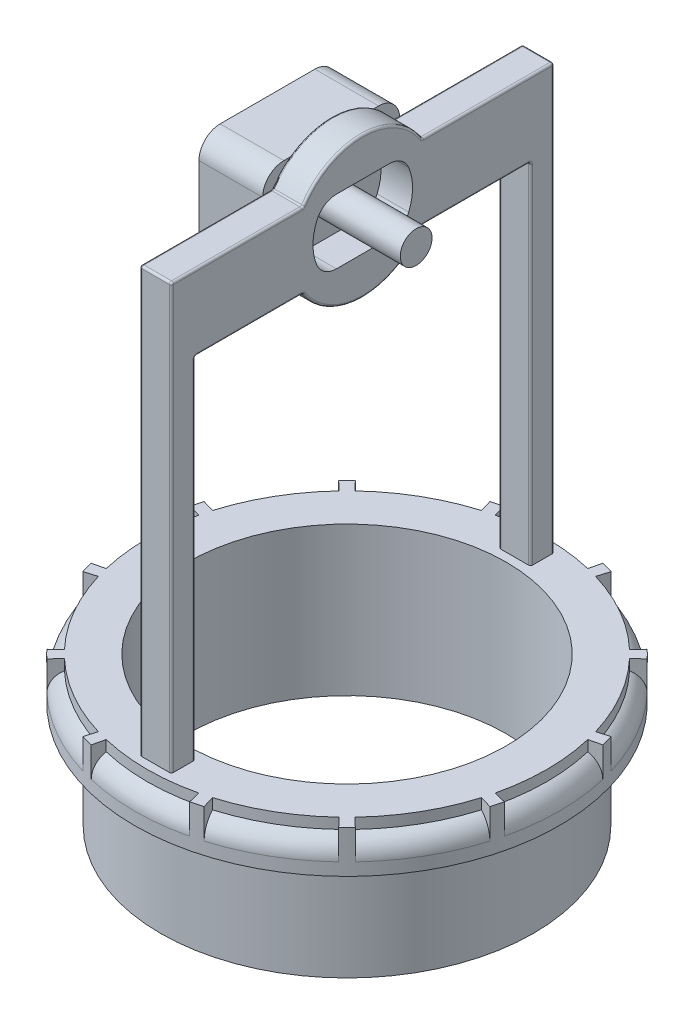
from build123d import *

# Parameters (mm, degrees)
SKETCH1_R           = 100
BOSS_EXTRUDE1_DEPTH = 20
SKETCH2_R           = 75
CUT_EXTRUDE1_DEPTH  = 20
BOSS_EXTRUDE2_START = 50
SKETCH3_R           = 87.864949358
SKETCH3_R_2         = 75
BOSS_EXTRUDE2_DEPTH = 50
CUT_EXTRUDE2_START  = -5
CUT_EXTRUDE2_DEPTH  = 5
FILLET1_START       = -1e-07
FILLET1_2_DEPTH     = 15.0000001
SKETCH5_W           = 14.86632225
SKETCH5_H           = 11.123248352
BOSS_EXTRUDE3_DEPTH = 200
BOSS_EXTRUDE4_REACH = 302.737
SKETCH6_W           = 14.86632225
SKETCH6_H           = 35.482101201
SKETCH7_R           = 33.276381549
BOSS_EXTRUDE5_DEPTH = 14.86632225
CUT_EXTRUDE3_DEPTH  = 278.522568948
FILLET2_R           = 1
BOSS_EXTRUDE6_DEPTH = 30
SKETCH10_R          = 7.5
BOSS_EXTRUDE7_DEPTH = 40


with BuildPart() as part:
    # Sketch1 → Boss-Extrude1 (new body)
    with BuildSketch(Plane(origin=(0, 0, 0), x_dir=(1, 0, 0), z_dir=(0, 1, 0))):
        with Locations(Location((0, 0, 0), (0, 0, 270))):
            Circle(SKETCH1_R)
    extrude(amount=BOSS_EXTRUDE1_DEPTH)

    # Sketch2 → Cut-Extrude1 (cut)
    with BuildSketch(Plane.XZ):
        with Locations(Location((0, 0, 0), (0, 0, 270))):
            Circle(SKETCH2_R)
    extrude(amount=-CUT_EXTRUDE1_DEPTH, mode=Mode.SUBTRACT)

    # Sketch3 → Boss-Extrude2 (add)
    with BuildSketch(Plane.XZ.offset(BOSS_EXTRUDE2_START)):
        with Locations(Location((0, 0, 0), (0, 0, 270))):
            Circle(SKETCH3_R)
        with Locations(Location((0, 0, 0), (0, 0, 270))):
            Circle(SKETCH3_R_2, mode=Mode.SUBTRACT)
    extrude(amount=-BOSS_EXTRUDE2_DEPTH)

    # Sketch4 → Cut-Extrude2 (cut)
    with BuildSketch(Plane(origin=(0, 20, 0), x_dir=(1, 0, 0), z_dir=(0, 1, 0)).offset(CUT_EXTRUDE2_START)):
        with BuildLine():
            Line((-23.19382118, 97.27305207), (-21.833368998, 91.567423188))
            ThreePointArc((-21.833368998, 91.567423188), (0, 94.1344198), (21.833368998, 91.567423188))
            Line((21.833368998, 91.567423188), (23.19382118, 97.27305207))
            ThreePointArc((23.19382118, 97.27305207), (0, 100), (-23.19382118, 97.27305207))
        make_face()
        with BuildLine():
            Line((28.550087682, 95.837844787), (26.875459392, 90.216399139))
            ThreePointArc((26.875459392, 90.216399139), (47.0672099, 81.522798918), (64.691963796, 68.383030141))
            Line((64.691963796, 68.383030141), (68.722964388, 72.644023606))
            ThreePointArc((68.722964388, 72.644023606), (50, 86.602540378), (28.550087682, 95.837844787))
        make_face()
        with BuildLine():
            Line((72.644023606, 68.722964388), (68.383030141, 64.691963796))
            ThreePointArc((68.383030141, 64.691963796), (81.522798918, 47.0672099), (90.216399139, 26.875459392))
            Line((90.216399139, 26.875459392), (95.837844787, 28.550087682))
            ThreePointArc((95.837844787, 28.550087682), (86.602540378, 50), (72.644023606, 68.722964388))
        make_face()
        with BuildLine():
            Line((97.27305207, 23.19382118), (91.567423188, 21.833368998))
            ThreePointArc((91.567423188, 21.833368998), (94.1344198, 0), (91.567423188, -21.833368998))
            Line((91.567423188, -21.833368998), (97.27305207, -23.19382118))
            ThreePointArc((97.27305207, -23.19382118), (100, 0), (97.27305207, 23.19382118))
        make_face()
        with BuildLine():
            Line((95.837844787, -28.550087682), (90.216399139, -26.875459392))
            ThreePointArc((90.216399139, -26.875459392), (81.522798918, -47.0672099), (68.383030141, -64.691963796))
            Line((68.383030141, -64.691963796), (72.644023606, -68.722964388))
            ThreePointArc((72.644023606, -68.722964388), (86.602540378, -50), (95.837844787, -28.550087682))
        make_face()
        with BuildLine():
            Line((68.722964388, -72.644023606), (64.691963796, -68.383030141))
            ThreePointArc((64.691963796, -68.383030141), (47.0672099, -81.522798918), (26.875459392, -90.216399139))
            Line((26.875459392, -90.216399139), (28.550087682, -95.837844787))
            ThreePointArc((28.550087682, -95.837844787), (50, -86.602540378), (68.722964388, -72.644023606))
        make_face()
        with BuildLine():
            Line((23.19382118, -97.27305207), (21.833368998, -91.567423188))
            ThreePointArc((21.833368998, -91.567423188), (0, -94.1344198), (-21.833368998, -91.567423188))
            Line((-21.833368998, -91.567423188), (-23.19382118, -97.27305207))
            ThreePointArc((-23.19382118, -97.27305207), (0, -100), (23.19382118, -97.27305207))
        make_face()
        with BuildLine():
            Line((-28.550087682, -95.837844787), (-26.875459392, -90.216399139))
            ThreePointArc((-26.875459392, -90.216399139), (-47.0672099, -81.522798918), (-64.691963796, -68.383030141))
            Line((-64.691963796, -68.383030141), (-68.722964388, -72.644023606))
            ThreePointArc((-68.722964388, -72.644023606), (-50, -86.602540378), (-28.550087682, -95.837844787))
        make_face()
        with BuildLine():
            Line((-72.644023606, -68.722964388), (-68.383030141, -64.691963796))
            ThreePointArc((-68.383030141, -64.691963796), (-81.522798918, -47.0672099), (-90.216399139, -26.875459392))
            Line((-90.216399139, -26.875459392), (-95.837844787, -28.550087682))
            ThreePointArc((-95.837844787, -28.550087682), (-86.602540378, -50), (-72.644023606, -68.722964388))
        make_face()
        with BuildLine():
            Line((-97.27305207, -23.19382118), (-91.567423188, -21.833368998))
            ThreePointArc((-91.567423188, -21.833368998), (-94.1344198, 0), (-91.567423188, 21.833368998))
            Line((-91.567423188, 21.833368998), (-97.27305207, 23.19382118))
            ThreePointArc((-97.27305207, 23.19382118), (-100, 0), (-97.27305207, -23.19382118))
        make_face()
        with BuildLine():
            Line((-95.837844787, 28.550087682), (-90.216399139, 26.875459392))
            ThreePointArc((-90.216399139, 26.875459392), (-81.522798918, 47.0672099), (-68.383030141, 64.691963796))
            Line((-68.383030141, 64.691963796), (-72.644023606, 68.722964388))
            ThreePointArc((-72.644023606, 68.722964388), (-86.602540378, 50), (-95.837844787, 28.550087682))
        make_face()
        with BuildLine():
            Line((-68.722964388, 72.644023606), (-64.691963796, 68.383030141))
            ThreePointArc((-64.691963796, 68.383030141), (-47.0672099, 81.522798918), (-26.875459392, 90.216399139))
            Line((-26.875459392, 90.216399139), (-28.550087682, 95.837844787))
            ThreePointArc((-28.550087682, 95.837844787), (-50, 86.602540378), (-68.722964388, 72.644023606))
        make_face()
    extrude(amount=CUT_EXTRUDE2_DEPTH, mode=Mode.SUBTRACT)

    # Fillet1: read off the stored shape, not the designer's step
    # Fillet1 outline → Fillet1 (revolve, cut)
    with BuildSketch(Plane.XY):
        with BuildLine():
            ThreePointArc((94.1344198, 15), (98.406669912, 11.310219416), (100, 5.894695342))
            Line((100, 5.894695342), (100, 15))
            Line((100, 15), (94.1344198, 15))
        make_face()
    revolve(axis=Axis((0, 0, 0), (0, 1, 0)), mode=Mode.SUBTRACT)

    # Fillet1 2 outline → Fillet1 2 (add)
    with BuildSketch(Plane(origin=(0, 0, 0), x_dir=(1, 0, 0), z_dir=(0, 1, 0)).offset(FILLET1_START)):
        with BuildLine():
            ThreePointArc((-28.550087682, -95.837844787), (-25.88190451, -96.592582629), (-23.19382118, -97.27305207))
            Line((-23.19382118, -97.27305207), (-21.833368998, -91.567423188))
            ThreePointArc((-21.833368998, -91.567423188), (-24.363780644, -90.926867228), (-26.875459392, -90.216399139))
            Line((-26.875459392, -90.216399139), (-28.550087682, -95.837844787))
        make_face()
        with BuildLine():
            Line((91.567423188, 21.833368998), (97.27305207, 23.19382118))
            ThreePointArc((97.27305207, 23.19382118), (96.592582629, 25.88190451), (95.837844787, 28.550087682))
            Line((95.837844787, 28.550087682), (90.216399139, 26.875459392))
            ThreePointArc((90.216399139, 26.875459392), (90.926867228, 24.363780644), (91.567423188, 21.833368998))
        make_face()
        with BuildLine():
            Line((68.383030141, 64.691963796), (72.644023606, 68.722964388))
            ThreePointArc((72.644023606, 68.722964388), (70.710678119, 70.710678119), (68.722964388, 72.644023606))
            Line((68.722964388, 72.644023606), (64.691963796, 68.383030141))
            ThreePointArc((64.691963796, 68.383030141), (66.563086584, 66.563086584), (68.383030141, 64.691963796))
        make_face()
        with BuildLine():
            Line((26.875459392, 90.216399139), (28.550087682, 95.837844787))
            ThreePointArc((28.550087682, 95.837844787), (25.88190451, 96.592582629), (23.19382118, 97.27305207))
            Line((23.19382118, 97.27305207), (21.833368998, 91.567423188))
            ThreePointArc((21.833368998, 91.567423188), (24.363780644, 90.926867228), (26.875459392, 90.216399139))
        make_face()
        with BuildLine():
            Line((-21.833368998, 91.567423188), (-23.19382118, 97.27305207))
            ThreePointArc((-23.19382118, 97.27305207), (-25.88190451, 96.592582629), (-28.550087682, 95.837844787))
            Line((-28.550087682, 95.837844787), (-26.875459392, 90.216399139))
            ThreePointArc((-26.875459392, 90.216399139), (-24.363780644, 90.926867228), (-21.833368998, 91.567423188))
        make_face()
        with BuildLine():
            Line((-64.691963796, 68.383030141), (-68.722964388, 72.644023606))
            ThreePointArc((-68.722964388, 72.644023606), (-70.710678119, 70.710678119), (-72.644023606, 68.722964388))
            Line((-72.644023606, 68.722964388), (-68.383030141, 64.691963796))
            ThreePointArc((-68.383030141, 64.691963796), (-66.563086584, 66.563086584), (-64.691963796, 68.383030141))
        make_face()
        with BuildLine():
            Line((-90.216399139, 26.875459392), (-95.837844787, 28.550087682))
            ThreePointArc((-95.837844787, 28.550087682), (-96.592582629, 25.88190451), (-97.27305207, 23.19382118))
            Line((-97.27305207, 23.19382118), (-91.567423188, 21.833368998))
            ThreePointArc((-91.567423188, 21.833368998), (-90.926867228, 24.363780644), (-90.216399139, 26.875459392))
        make_face()
        with BuildLine():
            ThreePointArc((-97.27305207, -23.19382118), (-96.592582629, -25.88190451), (-95.837844787, -28.550087682))
            Line((-95.837844787, -28.550087682), (-90.216399139, -26.875459392))
            ThreePointArc((-90.216399139, -26.875459392), (-90.926867228, -24.363780644), (-91.567423188, -21.833368998))
            Line((-91.567423188, -21.833368998), (-97.27305207, -23.19382118))
        make_face()
        with BuildLine():
            ThreePointArc((-72.644023606, -68.722964388), (-70.710678119, -70.710678119), (-68.722964388, -72.644023606))
            Line((-68.722964388, -72.644023606), (-64.691963796, -68.383030141))
            ThreePointArc((-64.691963796, -68.383030141), (-66.563086584, -66.563086584), (-68.383030141, -64.691963796))
            Line((-68.383030141, -64.691963796), (-72.644023606, -68.722964388))
        make_face()
        with BuildLine():
            ThreePointArc((23.19382118, -97.27305207), (25.88190451, -96.592582629), (28.550087682, -95.837844787))
            Line((28.550087682, -95.837844787), (26.875459392, -90.216399139))
            ThreePointArc((26.875459392, -90.216399139), (24.363780644, -90.926867228), (21.833368998, -91.567423188))
            Line((21.833368998, -91.567423188), (23.19382118, -97.27305207))
        make_face()
        with BuildLine():
            ThreePointArc((68.722964388, -72.644023606), (70.710678119, -70.710678119), (72.644023606, -68.722964388))
            Line((72.644023606, -68.722964388), (68.383030141, -64.691963796))
            ThreePointArc((68.383030141, -64.691963796), (66.563086584, -66.563086584), (64.691963796, -68.383030141))
            Line((64.691963796, -68.383030141), (68.722964388, -72.644023606))
        make_face()
        with BuildLine():
            ThreePointArc((95.837844787, -28.550087682), (96.592582629, -25.88190451), (97.27305207, -23.19382118))
            Line((97.27305207, -23.19382118), (91.567423188, -21.833368998))
            ThreePointArc((91.567423188, -21.833368998), (90.926867228, -24.363780644), (90.216399139, -26.875459392))
            Line((90.216399139, -26.875459392), (95.837844787, -28.550087682))
        make_face()
    extrude(amount=FILLET1_2_DEPTH)

    # Sketch5 → Boss-Extrude3 (add)
    with BuildSketch(Plane(origin=(0, 20, 0), x_dir=(1, 0, 0), z_dir=(0, 1, 0))):
        with Locations((0, 84.5672099)):
            Rectangle(SKETCH5_W, SKETCH5_H)
        with Locations((0, -84.5672099)):
            Rectangle(SKETCH5_W, SKETCH5_H)
    extrude(amount=BOSS_EXTRUDE3_DEPTH)

    # Sketch6 → Boss-Extrude4 (add, up to next)
    with BuildSketch(Plane(origin=(0, 0, 79.005585724), x_dir=(-1, 0, 0), z_dir=(0, 0, -1)), mode=Mode.PRIVATE) as boss_extrude4_sk1:
        with Locations((0, 202.2589494)):
            Rectangle(SKETCH6_W, SKETCH6_H)
    boss_extrude4_tool1 = extrude(boss_extrude4_sk1.sketch, amount=BOSS_EXTRUDE4_REACH, mode=Mode.PRIVATE) - part.part
    add(boss_extrude4_tool1.solids().sort_by_distance((0, 202.258949, 79.005586))[0])

    # Sketch7 → Boss-Extrude5 (add)
    with BuildSketch(Plane.ZY.offset(7.433161125)):
        with Locations((0, 202.258949399)):
            Circle(SKETCH7_R)
    extrude(amount=-BOSS_EXTRUDE5_DEPTH)

    # Sketch8 → Cut-Extrude3 (cut, through all)
    with BuildSketch(Plane.ZY.offset(7.433161125)):
        with BuildLine():
            Line((-12.405452312, 217.478972374), (12.405452312, 217.478972374))
            ThreePointArc((12.405452312, 217.478972374), (17.937869858, 215.80917982), (21.622689479, 211.357443594))
            ThreePointArc((21.622689479, 211.357443594), (23.4589705, 202.258949399), (21.622689479, 193.160455205))
            ThreePointArc((21.622689479, 193.160455205), (17.937869858, 188.708718978), (12.405452312, 187.038926425))
            Line((12.405452312, 187.038926425), (-12.405452312, 187.038926425))
            ThreePointArc((-12.405452312, 187.038926425), (-17.937869858, 188.708718978), (-21.622689479, 193.160455205))
            ThreePointArc((-21.622689479, 193.160455205), (-23.4589705, 202.258949399), (-21.622689479, 211.357443594))
            ThreePointArc((-21.622689479, 211.357443594), (-17.937869858, 215.80917982), (-12.405452312, 217.478972374))
        make_face()
    extrude(amount=-CUT_EXTRUDE3_DEPTH, mode=Mode.SUBTRACT)

    # Fillet2
    fillet2_edges = [part.edges().sort_by_distance(p)[0] for p in [
        (7.433161125, 120, -90.128834076),
        (-7.433161125, 120, -90.128834076),
        (7.433161125, 220, 59.140750834),
        (0, 220, -90.128834076),
        (-7.433161125, 220, -59.140750834),
        (-7.433161125, 120, 90.128834076),
        (7.433161125, 120, 90.128834076),
        (0, 220, 90.128834076),
        (-7.433161125, 102.258949399, 79.005585724),
        (7.433161125, 102.258949399, 79.005585724),
        (7.433161125, 102.258949399, -79.005585724),
        (-7.433161125, 102.258949399, -79.005585724),
        (0, 184.517898799, -79.005585724),
        (7.433161125, 184.517898799, -53.579126658),
        (0, 184.517898799, 79.005585724),
        (-7.433161125, 184.517898799, -53.579126658),
        (7.433161125, 184.517898799, 53.579126658),
        (-7.433161125, 184.517898799, 53.579126658),
        (0, 184.517898799, 28.152667593),
        (0, 184.517898799, -28.152667593),
        (7.433161125, 220, -59.140750834),
        (-7.433161125, 220, 59.140750834),
        (-7.433161125, 168.98256785, 0),
        (7.433161125, 168.98256785, 0),
        (0, 220, -28.152667593),
        (0, 220, 28.152667593),
        (-7.433161125, 235.535330948, 0),
        (7.433161125, 235.535330948, 0),
    ]]
    fillet(fillet2_edges, radius=FILLET2_R)

    # Sketch9 → Boss-Extrude6 (add)
    with BuildSketch(Plane.ZY.offset(7.433161125)):
        with BuildLine():
            Line((-22.289388611, 228.692589125), (22.289388611, 228.692589125))
            ThreePointArc((22.289388611, 228.692589125), (29.360456423, 225.763656937), (32.289388611, 218.692589125))
            Line((32.289388611, 218.692589125), (32.289388611, 185.825309673))
            ThreePointArc((32.289388611, 185.825309673), (29.360456423, 178.754241862), (22.289388611, 175.825309673))
            Line((22.289388611, 175.825309673), (-22.289388611, 175.825309673))
            ThreePointArc((-22.289388611, 175.825309673), (-29.360456423, 178.754241862), (-32.289388611, 185.825309673))
            Line((-32.289388611, 185.825309673), (-32.289388611, 218.692589125))
            ThreePointArc((-32.289388611, 218.692589125), (-29.360456423, 225.763656937), (-22.289388611, 228.692589125))
        make_face()
    extrude(amount=BOSS_EXTRUDE6_DEPTH)

    # Sketch10 → Boss-Extrude7 (add)
    with BuildSketch(Plane(origin=(-7.433161125, 0, 0), x_dir=(0, 0, -1), z_dir=(1, 0, 0))):
        with Locations((0, 202.258949399)):
            Circle(SKETCH10_R)
    extrude(amount=BOSS_EXTRUDE7_DEPTH)


solid = part.part
